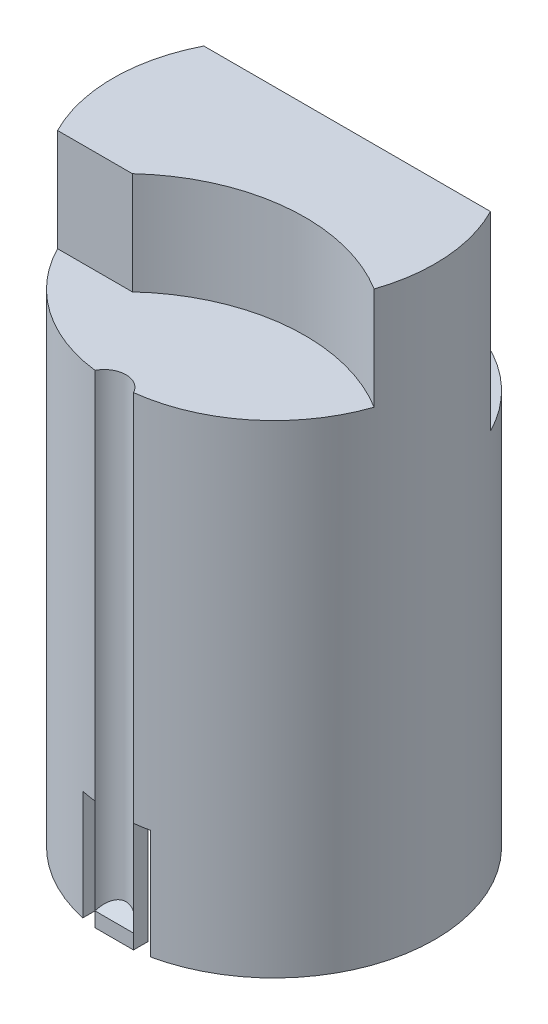
from build123d import *

# Parameters (mm, degrees)
SKETCH1_R           = 11
BOSS_EXTRUDE1_DEPTH = 40
CUT_EXTRUDE1_START  = -13
CUT_EXTRUDE1_DEPTH  = 13
CUT_EXTRUDE2_START  = -7
CUT_EXTRUDE2_DEPTH  = 7
CUT_EXTRUDE3_DEPTH  = 37.482872694
SKETCH6_R           = 10
CUT_EXTRUDE4_DEPTH  = 25
SKETCH7_W           = 1
SKETCH7_H           = 7.5
CUT_EXTRUDE5_DEPTH  = 7
SKETCH8_W           = 2.630926858
SKETCH8_H           = 1.007959983
BOSS_EXTRUDE2_DEPTH = 2
CHAMFER1_SIZE       = 1


with BuildPart() as part:
    # Sketch1 → Boss-Extrude1 (new body)
    with BuildSketch(Plane(origin=(0, 0, 0), x_dir=(1, 0, 0), z_dir=(0, 1, 0))):
        with Locations(Location((0, 0, 0), (0, 0, 270))):
            Circle(SKETCH1_R)
    extrude(amount=BOSS_EXTRUDE1_DEPTH)

    # Sketch2 → Cut-Extrude1 (cut)
    with BuildSketch(Plane(origin=(0, 40, 0), x_dir=(1, 0, 0), z_dir=(0, 1, 0)).offset(CUT_EXTRUDE1_START)):
        with BuildLine():
            Line((-9.797958971, 5), (9.797958971, 5))
            ThreePointArc((9.797958971, 5), (0, 11), (-9.797958971, 5))
        make_face()
    extrude(amount=CUT_EXTRUDE1_DEPTH, mode=Mode.SUBTRACT)

    # Sketch3 → Cut-Extrude2 (cut)
    with BuildSketch(Plane(origin=(0, 40, 0), x_dir=(1, 0, 0), z_dir=(0, 1, 0)).offset(CUT_EXTRUDE2_START)):
        with BuildLine():
            Line((-9.797958971, -5), (-4.683015841, -5))
            ThreePointArc((-4.683015841, -5), (2.619314521, -1.734147983), (10.406466307, -3.564471772))
            ThreePointArc((10.406466307, -3.564471772), (0.779586825, -10.972339968), (-9.797958971, -5))
        make_face()
    extrude(amount=CUT_EXTRUDE2_DEPTH, mode=Mode.SUBTRACT)

    # Sketch4 → Cut-Extrude3 (cut, through all)
    with BuildSketch(Plane(origin=(0, 33, 0), x_dir=(1, 0, 0), z_dir=(0, 1, 0))):
        with BuildLine():
            ThreePointArc((1.315463429, -10.921060203), (0, -10.120855836), (-1.315463429, -10.921060203))
            ThreePointArc((-1.315463429, -10.921060203), (0, -11), (1.315463429, -10.921060203))
        make_face()
    extrude(amount=-CUT_EXTRUDE3_DEPTH, mode=Mode.SUBTRACT)

    # Sketch6 → Cut-Extrude4 (cut)
    with BuildSketch(Plane.XZ):
        with Locations(Location((0, 0, 0), (0, 0, 270))):
            Circle(SKETCH6_R)
    extrude(amount=-CUT_EXTRUDE4_DEPTH, mode=Mode.SUBTRACT)

    # Sketch7 → Cut-Extrude5 (cut)
    with BuildSketch(Plane.XY.offset(12)):
        with Locations((-1.815463429, 3.75)):
            Rectangle(SKETCH7_W, SKETCH7_H)
        with Locations((1.815463429, 3.75)):
            Rectangle(SKETCH7_W, SKETCH7_H)
    extrude(amount=-CUT_EXTRUDE5_DEPTH, mode=Mode.SUBTRACT)

    # Sketch8 → Boss-Extrude2 (add)
    with BuildSketch(Plane.XZ):
        with Locations((0, 10.417080212)):
            Rectangle(SKETCH8_W, SKETCH8_H)
    extrude(amount=-BOSS_EXTRUDE2_DEPTH)

    # Chamfer1
    # the kernel refuses this chamfer: 1 mm, written as the material it takes off along each edge
    with BuildSketch(Plane(origin=(-3.887146417, 2, 10.921060203), x_dir=(-9.448986822191204e-15, 0.02749587661058651, -0.9996219169112968), z_dir=(1, 0, 0))) as chamfer1_piece_1_section:
        Polygon((CHAMFER1_SIZE * 0.999621916911, -CHAMFER1_SIZE * 0.0274958766106), (-CHAMFER1_SIZE * 0.0274958766106, -CHAMFER1_SIZE * 0.999621916911), (0, 0), align=None)
    chamfer1_piece_1 = extrude(amount=7.774292833, mode=Mode.PRIVATE)
    chamfer1_piece_1 = chamfer1_piece_1 & Plane(origin=(0, 1.631347526, 11.602209324), x_dir=(0.8880145347419771, 0, -0.45981538261240235), z_dir=(0, 1, 0)) * Cylinder(1.481353488, 20, mode=Mode.PRIVATE)
    add(chamfer1_piece_1, mode=Mode.SUBTRACT)


solid = part.part
